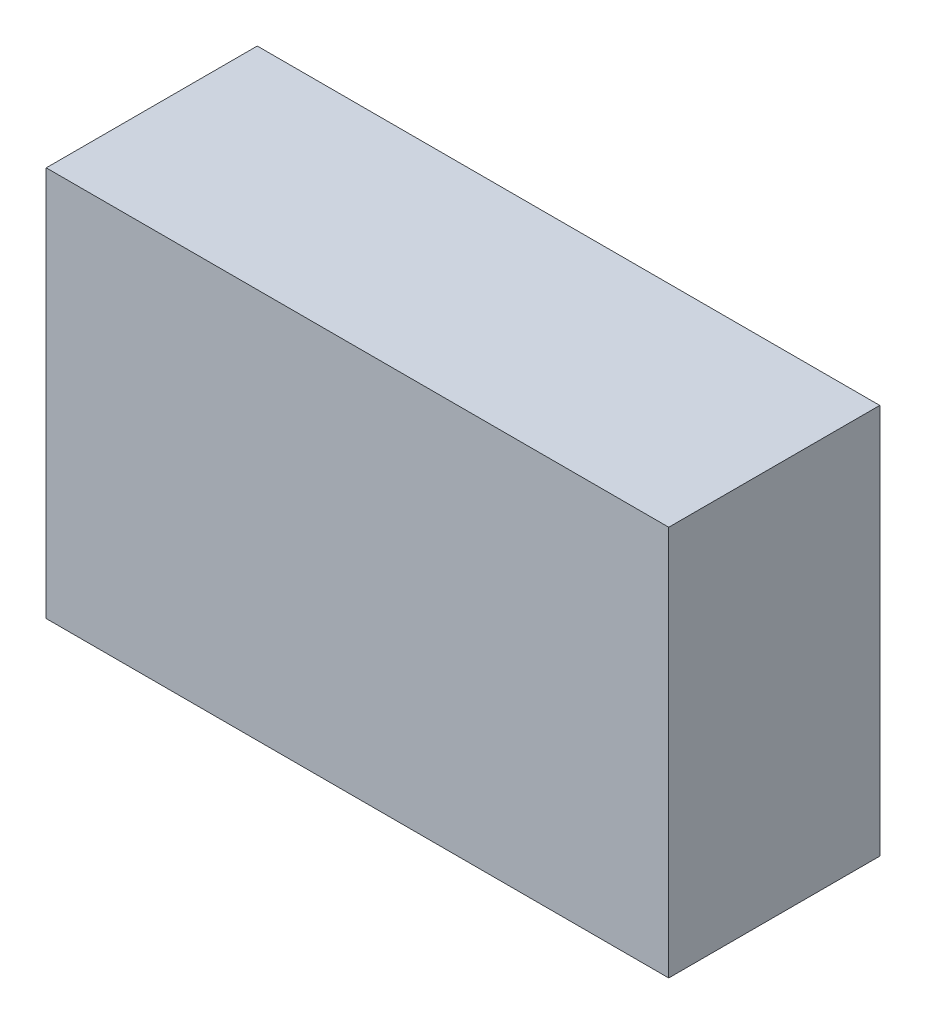
from build123d import *

# Parameters (mm, degrees)
SKETCH1_W           = 149.86
SKETCH1_H           = 50.8
BOSS_EXTRUDE1_DEPTH = 93.98


with BuildPart() as part:
    # Sketch1 → Boss-Extrude1 (new body)
    with BuildSketch(Plane(origin=(0, 0, 0), x_dir=(1, 0, 0), z_dir=(0, 1, 0))):
        with Locations((74.93, 25.4)):
            Rectangle(SKETCH1_W, SKETCH1_H)
    extrude(amount=BOSS_EXTRUDE1_DEPTH)


solid = part.part
